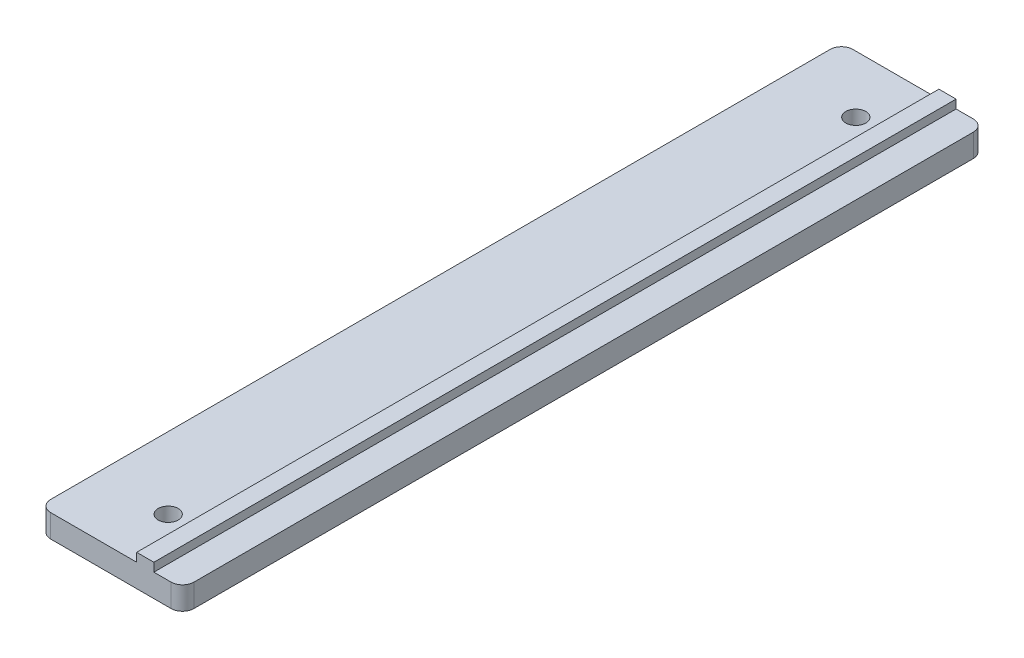
from build123d import *

# Parameters (mm, degrees)
SKETCH_1_W          = 25
SKETCH_1_H          = 140
EXTRUDE_1_DEPTH     = 4
FILLET_1_R          = 2
SKETCH_4_R          = 1.75
CUT_EXTRUDE_1_DEPTH = 10
SKETCH_6_W          = 3
SKETCH_6_H          = 140
EXTRUDE_3_DEPTH     = 1.5


with BuildPart() as part:
    # 草图1 → 凸台-拉伸1 (new body)
    with BuildSketch(Plane(origin=(0, 0, 0), x_dir=(1, 0, 0), z_dir=(0, 1, 0))):
        Rectangle(SKETCH_1_W, SKETCH_1_H)
    extrude(amount=EXTRUDE_1_DEPTH)

    # 圆角1
    fillet_1_edges = [part.edges().sort_by_distance(p)[0] for p in [
        (12.5, 2, -70),
        (-12.5, 2, -70),
        (-12.5, 2, 70),
        (12.5, 2, 70),
    ]]
    fillet(fillet_1_edges, radius=FILLET_1_R)

    # 草图4 → 切除-拉伸1 (cut)
    with BuildSketch(Plane(origin=(0, 4, 0), x_dir=(1, 0, 0), z_dir=(0, 1, 0))):
        with Locations((0, 60)):
            Circle(SKETCH_4_R)
        with Locations((0, -60)):
            Circle(SKETCH_4_R)
    extrude(amount=-CUT_EXTRUDE_1_DEPTH, mode=Mode.SUBTRACT)

    # 草图6 → 凸台-拉伸3 (add)
    with BuildSketch(Plane(origin=(0, 4, 0), x_dir=(1, 0, 0), z_dir=(0, 1, 0))):
        with Locations((6, 0)):
            Rectangle(SKETCH_6_W, SKETCH_6_H)
    extrude(amount=EXTRUDE_3_DEPTH)


solid = part.part
